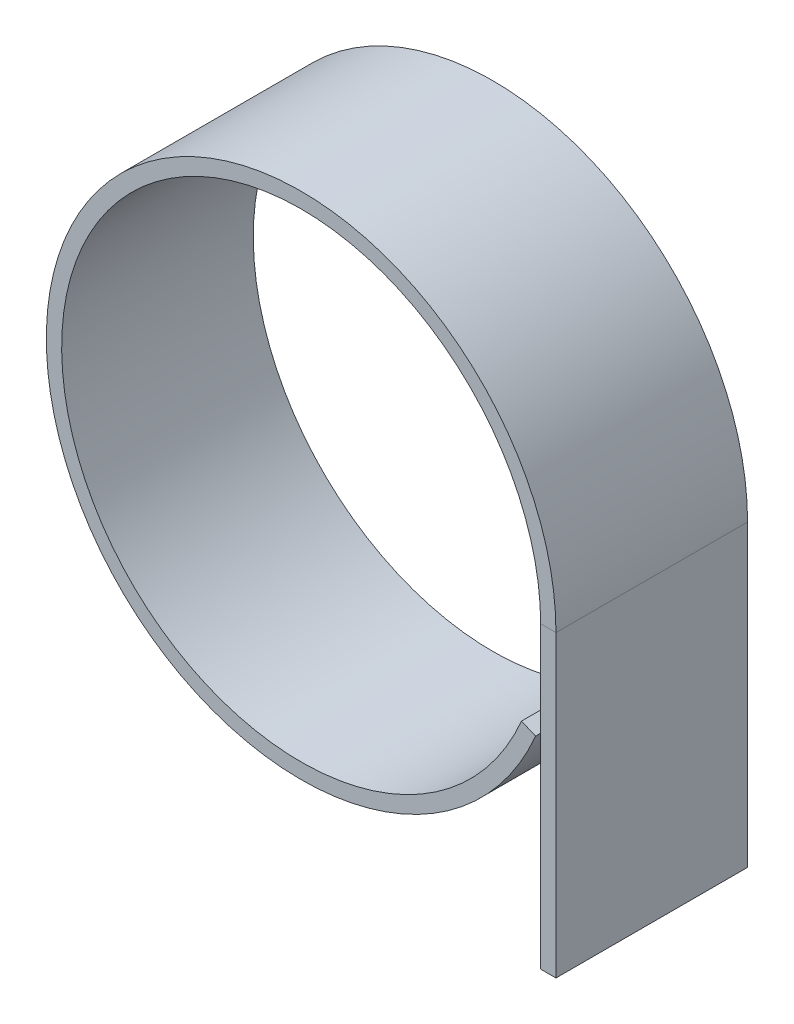
from build123d import *

# Parameters (mm, degrees)
BRIDA_BASE1_DEPTH = 10


# Sheet-metal steps are written as plain solids
with BuildPart() as part:
    # Croquis1 → Brida base1 (new body)
    with BuildSketch(Plane.XY):
        with BuildLine():
            Line((0, 0), (0, 15.612494996))
            ThreePointArc((0, 15.612494996), (-24.747448714, 18.112494996), (-1, 10.71351551))
            Line((-1, 10.71351551), (-0.264, 10.399980823))
            ThreePointArc((-0.264, 10.399980823), (-25.531285432, 18.272494996), (0.8, 15.612494996))
            Line((0.8, 15.612494996), (0.8, 0))
            Line((0.8, 0), (0, 0))
        make_face()
    extrude(amount=BRIDA_BASE1_DEPTH)


solid = part.part
